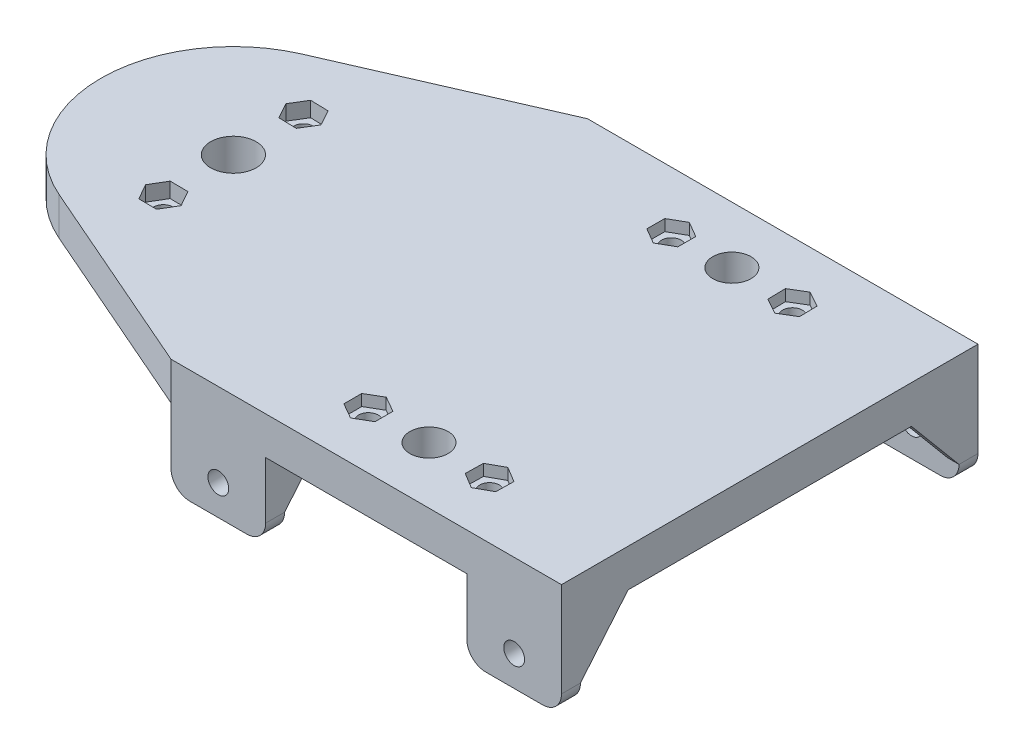
from build123d import *

# Parameters (mm, degrees)
SKETCH1_R            = 5.05
SKETCH1_R_2          = 6
SKETCH1_R_3          = 2.6
BOSS_EXTRUDE1_DEPTH  = 10
SKETCH3_W            = 25
SKETCH3_H            = 5
BOSS_EXTRUDE3_DEPTH  = 20
FILLET2_R            = 5
SKETCH4_R            = 2.75
CUT_EXTRUDE1_DEPTH   = 20
RIB9_REACH           = 120.579
SKETCH10_WALL_W      = 258.738758418
SKETCH10_WALL_H      = 3
RIB10_REACH          = 116.592
SKETCH11_WALL_W      = 250.765351916
SKETCH11_WALL_H      = 3
SKETCH12_W           = 25
SKETCH12_H           = 5
BOSS_EXTRUDE4_DEPTH  = 20
FILLET3_R            = 5
SKETCH13_R           = 2.75
CUT_EXTRUDE2_DEPTH   = 145.073688744
RIB11_REACH          = 188.093
SKETCH14_WALL_W      = 393.76792997
SKETCH14_WALL_H      = 3
RIB12_REACH          = 164.552
SKETCH15_WALL_W      = 347.125659706
SKETCH15_WALL_H      = 3
FILLET2_OF_MIRROR3_R = 5
FILLET3_OF_MIRROR3_R = 5
SKETCH16_W           = 29.246937375
SKETCH16_H           = 5
BOSS_EXTRUDE5_DEPTH  = 15
FILLET4_R            = 5
CUT_EXTRUDE3_REACH   = 116.006
SKETCH17_R           = 1.25
CUT_EXTRUDE4_DEPTH   = 4
CUT_EXTRUDE5_DEPTH   = 3


with BuildPart() as part:
    # Sketch1 → Boss-Extrude1 (new body)
    with BuildSketch(Plane(origin=(0, 0, 0), x_dir=(1, 0, 0), z_dir=(0, 1, 0))):
        with BuildLine():
            Line((-6.527225889, 55), (-59.0480575, 32.078029865))
            ThreePointArc((-59.0480575, 32.078029865), (-80.0480575, 0), (-59.0480575, -32.078029865))
            Line((-59.0480575, -32.078029865), (-6.527225889, -55))
            Line((-6.527225889, -55), (96.603456399, -55))
            Line((96.603456399, -55), (96.603456399, -40))
            Line((96.603456399, -40), (96.603456399, 55))
            Line((96.603456399, 55), (-6.527225889, 55))
        make_face()
        with Locations((46.603456399, 40)):
            Circle(SKETCH1_R, mode=Mode.SUBTRACT)
        with Locations((46.603456399, -40)):
            Circle(SKETCH1_R, mode=Mode.SUBTRACT)
        with Locations((-45.0480575, 0)):
            Circle(SKETCH1_R_2, mode=Mode.SUBTRACT)
        with Locations((30.603456399, 40)):
            Circle(SKETCH1_R_3, mode=Mode.SUBTRACT)
        with Locations((62.603456399, 40)):
            Circle(SKETCH1_R_3, mode=Mode.SUBTRACT)
        with Locations((30.603456399, -40)):
            Circle(SKETCH1_R_3, mode=Mode.SUBTRACT)
        with Locations((62.603456399, -40)):
            Circle(SKETCH1_R_3, mode=Mode.SUBTRACT)
        with Locations((-45.0480575, 18.5)):
            Circle(SKETCH1_R_3, mode=Mode.SUBTRACT)
        with Locations((-45.0480575, -18.5)):
            Circle(SKETCH1_R_3, mode=Mode.SUBTRACT)
    extrude(amount=BOSS_EXTRUDE1_DEPTH)

    # Sketch3 → Boss-Extrude3 (add)
    with BuildSketch(Plane.XZ):
        with Locations((5.972774111, -52.5)):
            Rectangle(SKETCH3_W, SKETCH3_H)
    boss_extrude3 = extrude(amount=BOSS_EXTRUDE3_DEPTH)

    # Fillet2
    fillet2_edges = [part.edges().sort_by_distance(p)[0] for p in [
        (-6.527225889, -20, -52.5),
        (18.472774111, -20, -52.5),
    ]]
    fillet(fillet2_edges, radius=FILLET2_R)

    # Sketch4 → Cut-Extrude1 (cut)
    with BuildSketch(Plane.XY.offset(-50)):
        with Locations((5.972774111, -12)):
            Circle(SKETCH4_R)
    cut_extrude1 = extrude(amount=-CUT_EXTRUDE1_DEPTH, mode=Mode.SUBTRACT)

    # Sketch10 wall → Rib9 (add, up to next)
    with BuildSketch(Plane(origin=(-6.527225889, -7.5, -43.706752766), x_dir=(0, 0.76604444311, 0.642787609697), z_dir=(0, 0.642787609697, -0.76604444311)), mode=Mode.PRIVATE) as rib9_sk1:
        with Locations((0, 1.5)):
            Rectangle(SKETCH10_WALL_W, SKETCH10_WALL_H)
    rib9_tool1 = extrude(rib9_sk1.sketch, amount=RIB9_REACH, mode=Mode.PRIVATE) - part.part
    rib9 = rib9_tool1.solids().sort_by_distance((-6.527225889, -7.5, -43.706752766))[0]
    add(rib9)

    # Sketch11 wall → Rib10 (add, up to next)
    with BuildSketch(Plane(origin=(18.472774111, -7.5, -43.706752766), x_dir=(0, 0.76604444311, 0.642787609697), z_dir=(0, -0.642787609697, 0.76604444311)), mode=Mode.PRIVATE) as rib10_sk1:
        with Locations((0, 1.5)):
            Rectangle(SKETCH11_WALL_W, SKETCH11_WALL_H)
    rib10_tool1 = extrude(rib10_sk1.sketch, amount=-RIB10_REACH, mode=Mode.PRIVATE) - part.part
    rib10 = rib10_tool1.solids().sort_by_distance((18.472774111, -7.5, -43.706752766))[0]
    add(rib10)

    # Sketch12 → Boss-Extrude4 (add)
    with BuildSketch(Plane.XZ):
        with Locations((84.103456399, -52.5)):
            Rectangle(SKETCH12_W, SKETCH12_H)
    boss_extrude4 = extrude(amount=BOSS_EXTRUDE4_DEPTH)

    # Fillet3
    fillet3_edges = [part.edges().sort_by_distance(p)[0] for p in [
        (96.603456399, -20, -52.5),
        (71.603456399, -20, -52.5),
    ]]
    fillet(fillet3_edges, radius=FILLET3_R)

    # Sketch13 → Cut-Extrude2 (cut, through all)
    with BuildSketch(Plane.XY.offset(-50)):
        with Locations((84.103456399, -12)):
            Circle(SKETCH13_R)
    cut_extrude2 = extrude(amount=-CUT_EXTRUDE2_DEPTH, mode=Mode.SUBTRACT)

    # Sketch14 wall → Rib11 (add, up to next)
    with BuildSketch(Plane(origin=(96.603456399, -7.5, -43.706752766), x_dir=(0, 0.76604444311, 0.642787609697), z_dir=(0, -0.642787609697, 0.76604444311)), mode=Mode.PRIVATE) as rib11_sk1:
        with Locations((0, 1.5)):
            Rectangle(SKETCH14_WALL_W, SKETCH14_WALL_H)
    rib11_tool1 = extrude(rib11_sk1.sketch, amount=-RIB11_REACH, mode=Mode.PRIVATE) - part.part
    rib11 = rib11_tool1.solids().sort_by_distance((96.603456399, -7.5, -43.706752766))[0]
    add(rib11)

    # Sketch15 wall → Rib12 (add, up to next)
    with BuildSketch(Plane(origin=(71.603456399, -7.331327668, -43.565219875), x_dir=(0, 0.766044443114, 0.642787609692), z_dir=(0, 0.642787609692, -0.766044443114)), mode=Mode.PRIVATE) as rib12_sk1:
        with Locations((0, 1.5)):
            Rectangle(SKETCH15_WALL_W, SKETCH15_WALL_H)
    rib12_tool1 = extrude(rib12_sk1.sketch, amount=RIB12_REACH, mode=Mode.PRIVATE) - part.part
    rib12 = rib12_tool1.solids().sort_by_distance((71.603456399, -7.331327668, -43.565219875))[0]
    add(rib12)

    # Mirror3: Boss-Extrude3, Cut-Extrude1, Rib9, Rib10, Boss-Extrude4, Cut-Extrude2, Rib11, Rib12 across plane
    add(boss_extrude3.mirror(Plane.XY))
    add(cut_extrude1.mirror(Plane.XY), mode=Mode.SUBTRACT)
    add(rib9.mirror(Plane.XY))
    add(rib10.mirror(Plane.XY))
    add(boss_extrude4.mirror(Plane.XY))
    add(cut_extrude2.mirror(Plane.XY), mode=Mode.SUBTRACT)
    add(rib11.mirror(Plane.XY))
    add(rib12.mirror(Plane.XY))

    # Fillet2 of Mirror3
    fillet2_of_mirror3_edges = [part.edges().sort_by_distance(p)[0] for p in [
        (-6.527225889, -20, 52.5),
        (18.472774111, -20, 52.5),
    ]]
    fillet(fillet2_of_mirror3_edges, radius=FILLET2_OF_MIRROR3_R)

    # Fillet3 of Mirror3
    fillet3_of_mirror3_edges = [part.edges().sort_by_distance(p)[0] for p in [
        (96.603456399, -20, 52.5),
        (71.603456399, -20, 52.5),
    ]]
    fillet(fillet3_of_mirror3_edges, radius=FILLET3_OF_MIRROR3_R)

    # Sketch16 → Boss-Extrude5 (add)
    with BuildSketch(Plane.XZ):
        with Locations((-6.030626379, 4.641549892)):
            Rectangle(SKETCH16_W, SKETCH16_H)
    extrude(amount=BOSS_EXTRUDE5_DEPTH)

    # Fillet4
    fillet4_edges = [part.edges().sort_by_distance(p)[0] for p in [
        (8.592842309, -15, 4.641549892),
        (-20.654095066, -15, 4.641549892),
    ]]
    fillet(fillet4_edges, radius=FILLET4_R)

    # Sketch17 → Cut-Extrude3 (cut, up to next)
    with BuildSketch(Plane(origin=(0, 0, 2.141549892), x_dir=(-1, 0, 0), z_dir=(0, 0, -1)), mode=Mode.PRIVATE) as cut_extrude3_sk1:
        with Locations((0, -10.207909403)):
            Circle(SKETCH17_R)
    cut_extrude3_tool1 = extrude(cut_extrude3_sk1.sketch, amount=-CUT_EXTRUDE3_REACH, mode=Mode.PRIVATE) & part.part
    # Sketch17 → Cut-Extrude3 (cut, up to next)
    with BuildSketch(Plane(origin=(0, 0, 2.141549892), x_dir=(-1, 0, 0), z_dir=(0, 0, -1)), mode=Mode.PRIVATE) as cut_extrude3_sk2:
        with Locations((9.5, -10.207909403)):
            Circle(SKETCH17_R)
    cut_extrude3_tool2 = extrude(cut_extrude3_sk2.sketch, amount=-CUT_EXTRUDE3_REACH, mode=Mode.PRIVATE) & part.part
    add(cut_extrude3_tool1.solids().sort_by_distance((0, -10.207909, 2.14155))[0], mode=Mode.SUBTRACT)
    add(cut_extrude3_tool2.solids().sort_by_distance((-9.5, -10.207909, 2.14155))[0], mode=Mode.SUBTRACT)

    # Sketch19 → Cut-Extrude4 (cut)
    with BuildSketch(Plane(origin=(0, 10, 0), x_dir=(1, 0, 0), z_dir=(0, 1, 0))):
        Polygon((-42.788929966, 14.33951011), (-40.315403797, 18.37621689), (-42.57453133, 22.536706779), (-47.307185033, 22.66048989), (-49.780711203, 18.62378311), (-47.52158367, 14.463293221), align=None)
        Polygon((-42.729558415, -22.627698551), (-40.314116153, -18.555970169), (-42.632615238, -14.428271618), (-47.366556585, -14.372301449), (-49.781998846, -18.444029831), (-47.463499761, -22.571728382), align=None)
    extrude(amount=-CUT_EXTRUDE4_DEPTH, mode=Mode.SUBTRACT)

    # Sketch20 → Cut-Extrude5 (cut)
    with BuildSketch(Plane(origin=(0, 10, 0), x_dir=(1, 0, 0), z_dir=(0, 1, 0))):
        Polygon((58.549967326, 37.554072841), (62.694946918, 35.266611909), (66.748435991, 37.712539068), (66.656945472, 42.445927159), (62.51196588, 44.733388091), (58.458476807, 42.287460932), align=None)
        Polygon((26.494447933, 37.648536039), (30.585379692, 35.265762304), (34.694388158, 37.617226264), (34.712464865, 42.351463961), (30.621533106, 44.734237696), (26.51252464, 42.382773736), align=None)
        Polygon((58.549967326, -37.554072841), (58.458476807, -42.287460932), (62.51196588, -44.733388091), (66.656945472, -42.445927159), (66.748435991, -37.712539068), (62.694946918, -35.266611909), align=None)
        Polygon((26.494447933, -37.648536039), (26.51252464, -42.382773736), (30.621533106, -44.734237696), (34.712464865, -42.351463961), (34.694388158, -37.617226264), (30.585379692, -35.265762304), align=None)
    extrude(amount=-CUT_EXTRUDE5_DEPTH, mode=Mode.SUBTRACT)


solid = part.part
